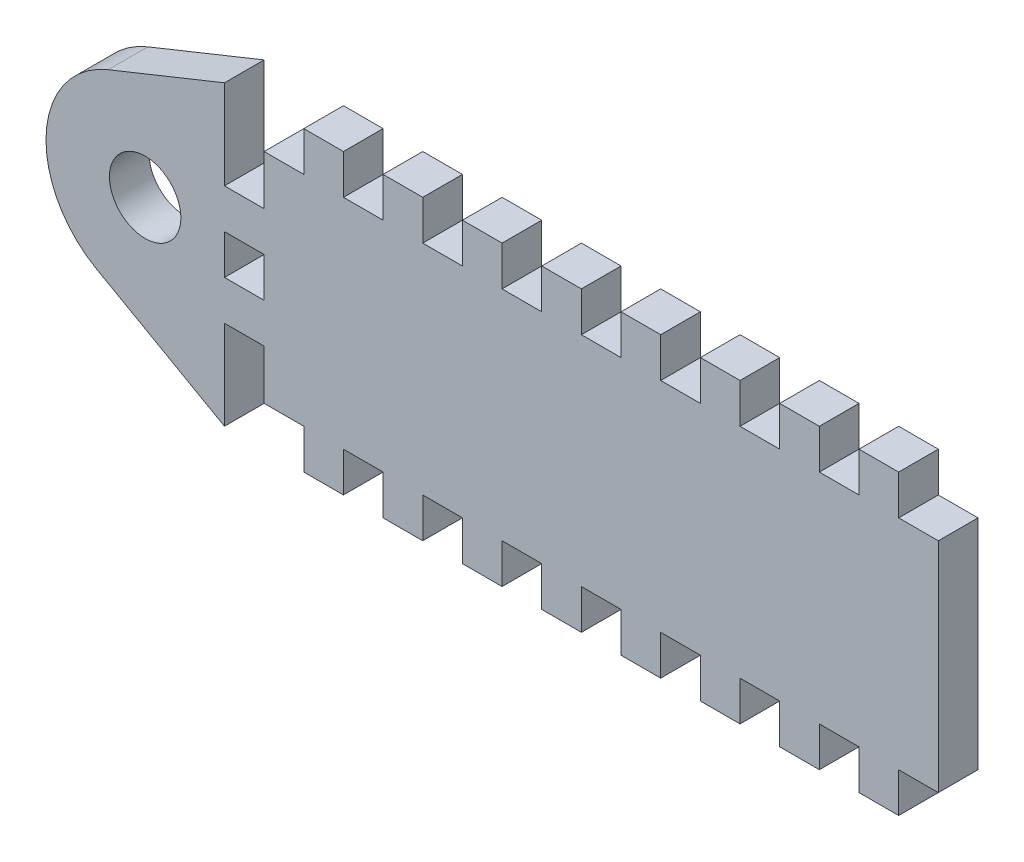
from build123d import *

# Parameters (mm, degrees)
MASS_DEPTH          = 6.35
SKETCH4_R           = 5.715
CUT_EXTRUDE1_DEPTH  = 102.024858757
SKETCH3_W           = 6.35
SKETCH3_H           = 12.7
CUT_EXTRUDE2_DEPTH  = 102.024858757
CAVITY1_START       = -14.457315323
CAVITY1_OUTLINE_W   = 6.35
CAVITY1_OUTLINE_H   = 6.35
CAVITY1_DEPTH       = 14.2875
CAVITY1_START_2     = 18.880184677
CAVITY1_2_OUTLINE_W = 6.35
CAVITY1_2_OUTLINE_H = 6.35
CAVITY1_2_DEPTH     = 14.2875
CAVITY1_START_3     = 6.180184677
CAVITY1_3_OUTLINE_W = 6.35
CAVITY1_3_OUTLINE_H = 6.35
CAVITY1_3_DEPTH     = 6.35
LPATTERN1_COUNT     = 9
LPATTERN1_PITCH     = 12.7


# Read off the part's stored shape, not the designer's step: Cavity1
with BuildPart() as part:
    # Sketch1 → Mass (new body)
    with BuildSketch(Plane.XY):
        with BuildLine():
            Line((-19.086533096, -14.457315323), (95.213466904, -14.457315323))
            Line((95.213466904, -14.457315323), (95.213466904, 33.167684677))
            Line((95.213466904, 33.167684677), (-19.086533096, 33.167684677))
            Line((-19.086533096, 33.167684677), (-37.714474787, 25.669365644))
            ThreePointArc((-37.714474787, 25.669365644), (-47.627354737, 11.983835347), (-39.590998194, -2.881422872))
            Line((-39.590998194, -2.881422872), (-19.086533096, -14.457315323))
        make_face()
    extrude(amount=MASS_DEPTH)

    # Sketch4 → Cut-Extrude1 (cut, through all)
    with BuildSketch(Plane(origin=(0, 0, 0), x_dir=(-1, 0, 0), z_dir=(0, 0, -1))):
        with Locations((31.786533096, 10.942684677)):
            Circle(SKETCH4_R)
    extrude(amount=-CUT_EXTRUDE1_DEPTH, mode=Mode.SUBTRACT)

    # Sketch3 → Cut-Extrude2 (cut, through all)
    with BuildSketch(Plane(origin=(0, 0, 0), x_dir=(-1, 0, 0), z_dir=(0, 0, -1))):
        with Locations((-92.038466904, 33.164228805)):
            Rectangle(SKETCH3_W, SKETCH3_H)
        with Locations((-92.038466904, -14.457315323)):
            Rectangle(SKETCH3_W, SKETCH3_H)
    cut_extrude2 = extrude(amount=-CUT_EXTRUDE2_DEPTH, mode=Mode.SUBTRACT)

    # Cavity1 outline → Cavity1 (cut)
    with BuildSketch(Plane(origin=(0, 0, 0), x_dir=(1, 0, 0), z_dir=(0, 1, 0)).offset(CAVITY1_START)):
        with Locations((-15.911533096, -3.175)):
            Rectangle(CAVITY1_OUTLINE_W, CAVITY1_OUTLINE_H)
    extrude(amount=CAVITY1_DEPTH, mode=Mode.SUBTRACT)

    # Cavity1 2 outline → Cavity1 2 (cut)
    with BuildSketch(Plane(origin=(0, 0, 0), x_dir=(1, 0, 0), z_dir=(0, 1, 0)).offset(CAVITY1_START_2)):
        with Locations((-15.911533096, -3.175)):
            Rectangle(CAVITY1_2_OUTLINE_W, CAVITY1_2_OUTLINE_H)
    extrude(amount=CAVITY1_2_DEPTH, mode=Mode.SUBTRACT)

    # Cavity1 3 outline → Cavity1 3 (cut)
    with BuildSketch(Plane(origin=(0, 0, 0), x_dir=(1, 0, 0), z_dir=(0, 1, 0)).offset(CAVITY1_START_3)):
        with Locations((-15.911533096, -3.175)):
            Rectangle(CAVITY1_3_OUTLINE_W, CAVITY1_3_OUTLINE_H)
    extrude(amount=CAVITY1_3_DEPTH, mode=Mode.SUBTRACT)

    # LPattern1: Cut-Extrude2 ×9
    with Locations(*[(-i * LPATTERN1_PITCH, 0, 0) for i in range(1, LPATTERN1_COUNT)]):
        add(cut_extrude2, mode=Mode.SUBTRACT)


solid = part.part
